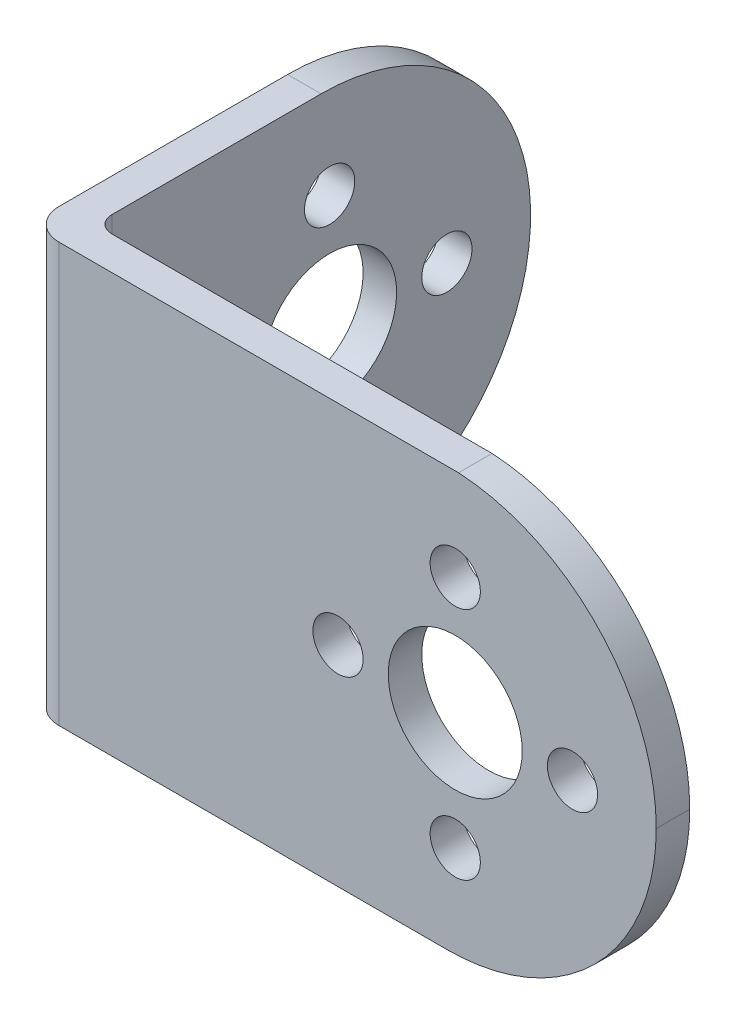
from build123d import *
from OCP.BRepAlgoAPI import BRepAlgoAPI_Cut
from OCP.TopTools import TopTools_ListOfShape

# Parameters (mm, degrees)
SALIENTE_EXTRUIR1_DEPTH     = 25
CROQUIS2_R                  = 4
CROQUIS2_R_2                = 1.5
CORTAR_EXTRUIR1_DEPTH       = 25
CORTAR_EXTRUIR2_START       = -2
CORTAR_EXTRUIR2_OUTLINE_R   = 1.5
CORTAR_EXTRUIR2_OUTLINE_R_2 = 4
CORTAR_EXTRUIR2_DEPTH       = 2


with BuildPart() as part:
    # Croquis1 → Saliente-Extruir1 (new body)
    with BuildSketch(Plane(origin=(0, 0, 0), x_dir=(1, 0, 0), z_dir=(0, 1, 0))):
        with BuildLine():
            Line((0, 1.84), (0, 28))
            Line((0, 28), (2, 28))
            Line((2, 28), (2, 3))
            ThreePointArc((2, 3), (2.292893219, 2.292893219), (3, 2))
            Line((3, 2), (37.5, 2))
            Line((37.5, 2), (37.5, 0))
            Line((37.5, 0), (1.84, 0))
            ThreePointArc((1.84, 0), (0.538923523, 0.538923523), (0, 1.84))
        make_face()
    extrude(amount=SALIENTE_EXTRUIR1_DEPTH)

    # Croquis2 → Cortar-Extruir1 (cut)
    with BuildSketch(Plane.ZY):
        with Locations((-16, 12.49)):
            Circle(CROQUIS2_R)
        with Locations((-23, 12.49)):
            Circle(CROQUIS2_R_2)
        with BuildLine():
            ThreePointArc((-16.197106781, 0), (-24.582469572, 3.897730388), (-28, 12.49))
            Line((-28, 12.49), (-28, 0))
            Line((-28, 0), (-16.197106781, 0))
        make_face()
        with BuildLine():
            Line((-28, 25), (-28, 12.49))
            ThreePointArc((-28, 12.49), (-24.335905833, 21.335905833), (-15.49, 25))
            Line((-15.49, 25), (-28, 25))
        make_face()
        with Locations((-9, 12.49)):
            Circle(CROQUIS2_R_2)
        with Locations((-16, 19.49)):
            Circle(CROQUIS2_R_2)
        with Locations((-16, 5.49)):
            Circle(CROQUIS2_R_2)
    extrude(amount=-CORTAR_EXTRUIR1_DEPTH, mode=Mode.SUBTRACT)


with BuildPart() as cortar_extruir2_tool:
    # Cortar-Extruir2: read off the stored shape, not the designer's step
    # Cortar-Extruir2 outline → Cortar-Extruir2 (new body)
    with BuildSketch(Plane.XY.offset(CORTAR_EXTRUIR2_START)):
        with BuildLine():
            ThreePointArc((25.697106781, 25), (34.082469572, 21.102269612), (37.5, 12.51))
            Line((37.5, 12.51), (37.5, 25))
            Line((37.5, 25), (25.697106781, 25))
        make_face()
        with BuildLine():
            Line((37.5, 0), (37.499996003, 12.500000002))
            ThreePointArc((37.499996003, 12.500000002), (33.832369592, 3.66055934), (24.99, 0))
            Line((24.99, 0), (37.5, 0))
        make_face()
        with Locations((18.5, 12.5)):
            Circle(CORTAR_EXTRUIR2_OUTLINE_R)
        with Locations((25.5, 19.5)):
            Circle(CORTAR_EXTRUIR2_OUTLINE_R)
        with Locations((25.5, 5.5)):
            Circle(CORTAR_EXTRUIR2_OUTLINE_R)
        with Locations((25.5, 12.5)):
            Circle(CORTAR_EXTRUIR2_OUTLINE_R_2)
        with Locations((32.5, 12.5)):
            Circle(CORTAR_EXTRUIR2_OUTLINE_R)
    extrude(amount=CORTAR_EXTRUIR2_DEPTH)


with BuildPart() as part_1:
    add(part.part)

    # Cortar-Extruir2: cut by cortar_extruir2_tool, with a tolerance
    cortar_extruir2_stock = TopTools_ListOfShape()
    cortar_extruir2_stock.Append(part_1.part.wrapped)
    cortar_extruir2_tools = TopTools_ListOfShape()
    cortar_extruir2_tools.Append(cortar_extruir2_tool.part.wrapped)
    cortar_extruir2_cut = BRepAlgoAPI_Cut()
    cortar_extruir2_cut.SetArguments(cortar_extruir2_stock)
    cortar_extruir2_cut.SetTools(cortar_extruir2_tools)
    cortar_extruir2_cut.SetFuzzyValue(0.00001)
    cortar_extruir2_cut.Build()
    add(Compound.cast(cortar_extruir2_cut.Shape()).solids(), mode=Mode.REPLACE)


solid = part_1.part
